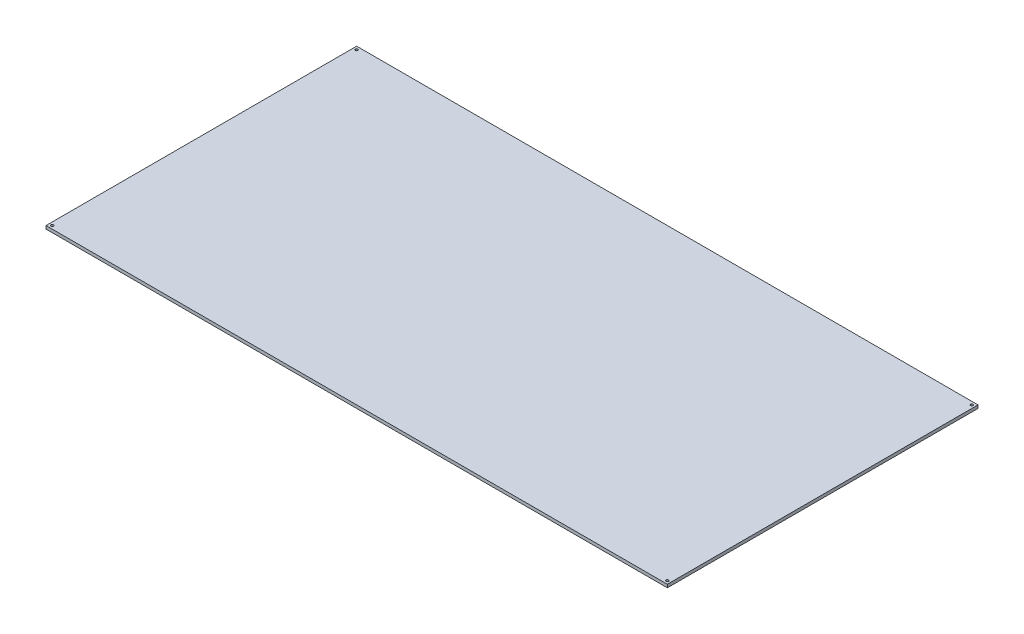
from build123d import *

# Parameters (mm, degrees)
SKETCH_1_W          = 2000
SKETCH_1_H          = 1000
EXTRUDE_1_DEPTH     = 10
SKETCH_2_R          = 4
CUT_EXTRUDE_1_DEPTH = 10


with BuildPart() as part:
    # 草图1 → 凸台-拉伸1 (new body)
    with BuildSketch(Plane(origin=(0, 0, 0), x_dir=(1, 0, 0), z_dir=(0, 1, 0))):
        with Locations((28.294417173, -45.202770246)):
            Rectangle(SKETCH_1_W, SKETCH_1_H)
    extrude(amount=EXTRUDE_1_DEPTH)

    # 草图2 → 切除-拉伸1 (cut)
    with BuildSketch(Plane(origin=(0, 10, 0), x_dir=(1, 0, 0), z_dir=(0, 1, 0))):
        with Locations((-961.705582827, 444.797229754)):
            Circle(SKETCH_2_R)
        with Locations((1018.294417173, 444.797229754)):
            Circle(SKETCH_2_R)
        with Locations((1018.294417173, -535.202770246)):
            Circle(SKETCH_2_R)
        with Locations((-961.705582827, -535.202770246)):
            Circle(SKETCH_2_R)
    extrude(amount=-CUT_EXTRUDE_1_DEPTH, mode=Mode.SUBTRACT)


solid = part.part
